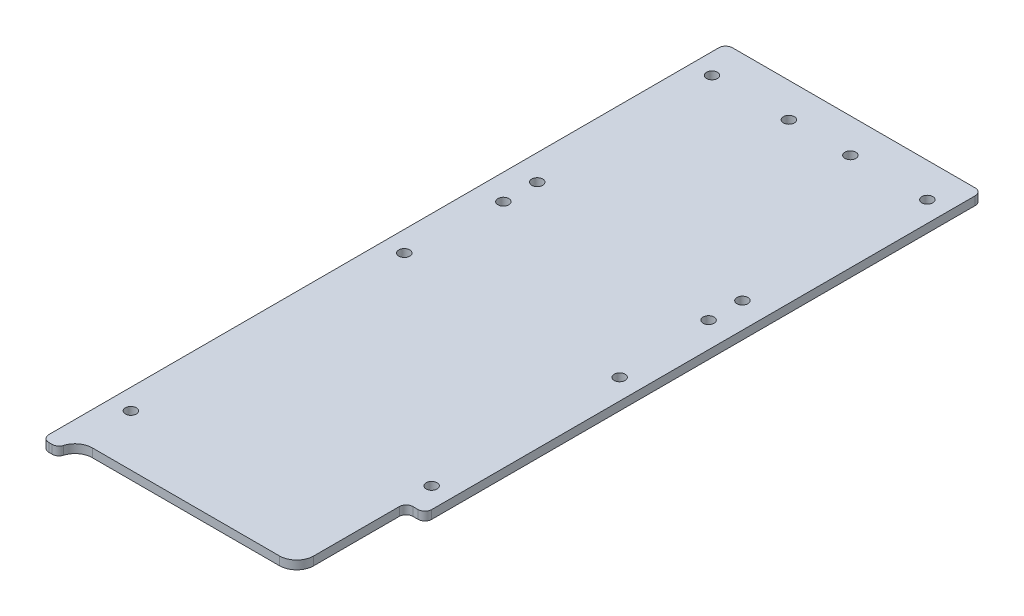
from build123d import *

# Parameters (mm, degrees)
SKETCH1_R           = 2.032
BOSS_EXTRUDE1_DEPTH = 3.175
FILLET1_R           = 2.54
FILLET2_R           = 2.54
FILLET3_R           = 6.35
CUT_EXTRUDE1_DEPTH  = 136.673215063
FILLET4_R           = 6.35
FILLET5_R           = 2.54
SKETCH3_R           = 2.032
CUT_EXTRUDE2_DEPTH  = 136.673215063


with BuildPart() as part:
    # Sketch1 → Boss-Extrude1 (new body)
    with BuildSketch(Plane(origin=(0, 0, 0), x_dir=(1, 0, 0), z_dir=(0, 1, 0))):
        Polygon((47.625, 127), (-47.625, 127), (-47.625, -127), (-41.275, -127), (-41.275, -120.65), (41.275, -120.65), (41.275, -127), (47.625, -127), align=None)
        with Locations((-39.999684148, -101.6)):
            Circle(SKETCH1_R, mode=Mode.SUBTRACT)
        with Locations((39.999684148, -69.85)):
            Circle(SKETCH1_R, mode=Mode.SUBTRACT)
        with Locations((-39.999684148, 0)):
            Circle(SKETCH1_R, mode=Mode.SUBTRACT)
        with Locations((-39.999684148, 114.3)):
            Circle(SKETCH1_R, mode=Mode.SUBTRACT)
        with Locations((-11.424684148, 114.3)):
            Circle(SKETCH1_R, mode=Mode.SUBTRACT)
        with Locations((39.999684148, 0)):
            Circle(SKETCH1_R, mode=Mode.SUBTRACT)
        with Locations((11.424684148, 114.3)):
            Circle(SKETCH1_R, mode=Mode.SUBTRACT)
        with Locations((39.999684148, 114.3)):
            Circle(SKETCH1_R, mode=Mode.SUBTRACT)
    extrude(amount=BOSS_EXTRUDE1_DEPTH)

    # Fillet1
    fillet1_edges = [part.edges().sort_by_distance(p)[0] for p in [
        (-47.625, 1.5875, -127),
        (47.625, 1.5875, -127),
        (47.625, 1.5875, 127),
        (-47.625, 1.5875, 127),
    ]]
    fillet(fillet1_edges, radius=FILLET1_R)

    # Fillet2
    fillet2_edges = [part.edges().sort_by_distance(p)[0] for p in [
        (41.275, 1.5875, 127),
        (-41.275, 1.5875, 127),
    ]]
    fillet(fillet2_edges, radius=FILLET2_R)

    # Fillet3
    fillet3_edges = [part.edges().sort_by_distance(p)[0] for p in [
        (41.275, 1.5875, 120.65),
        (-41.275, 1.5875, 120.65),
    ]]
    fillet(fillet3_edges, radius=FILLET3_R)

    # Sketch2 → Cut-Extrude1 (cut, through all)
    with BuildSketch(Plane.XZ):
        with BuildLine():
            Line((47.625, 131.883089137), (41.910626631, 131.883089137))
            Line((41.910626631, 131.883089137), (41.910626631, 126.140762349))
            ThreePointArc((41.910626631, 126.140762349), (41.593815686, 125.692047177), (41.380880287, 125.185714286))
            ThreePointArc((41.380880287, 125.185714286), (41.067446116, 124.352723447), (40.640626631, 123.571736991))
            Line((40.640626631, 123.571736991), (40.640626631, 79.981419179))
            Line((40.640626631, 79.981419179), (47.625, 79.981419179))
            Line((47.625, 79.981419179), (47.625, 131.883089137))
        make_face()
    extrude(amount=-CUT_EXTRUDE1_DEPTH, mode=Mode.SUBTRACT)

    # Fillet4
    fillet4_edges = [part.edges().sort_by_distance(p)[0] for p in [
        (40.640626631, 1.5875, 123.571736991),
    ]]
    fillet(fillet4_edges, radius=FILLET4_R)

    # Fillet5
    fillet5_edges = [part.edges().sort_by_distance(p)[0] for p in [
        (47.625, 1.5875, 79.981419179),
        (40.640626631, 1.5875, 79.981419179),
    ]]
    fillet(fillet5_edges, radius=FILLET5_R)

    # Sketch3 → Cut-Extrude2 (cut, through all)
    with BuildSketch(Plane.XZ):
        with Locations((-38.113296794, -34.913768806)):
            Circle(SKETCH3_R)
        with Locations((-38.113296794, -47.490173279)):
            Circle(SKETCH3_R)
        with Locations((38.113296794, -47.490173279)):
            Circle(SKETCH3_R)
        with Locations((38.113296794, -34.913768806)):
            Circle(SKETCH3_R)
    extrude(amount=-CUT_EXTRUDE2_DEPTH, mode=Mode.SUBTRACT)


solid = part.part
